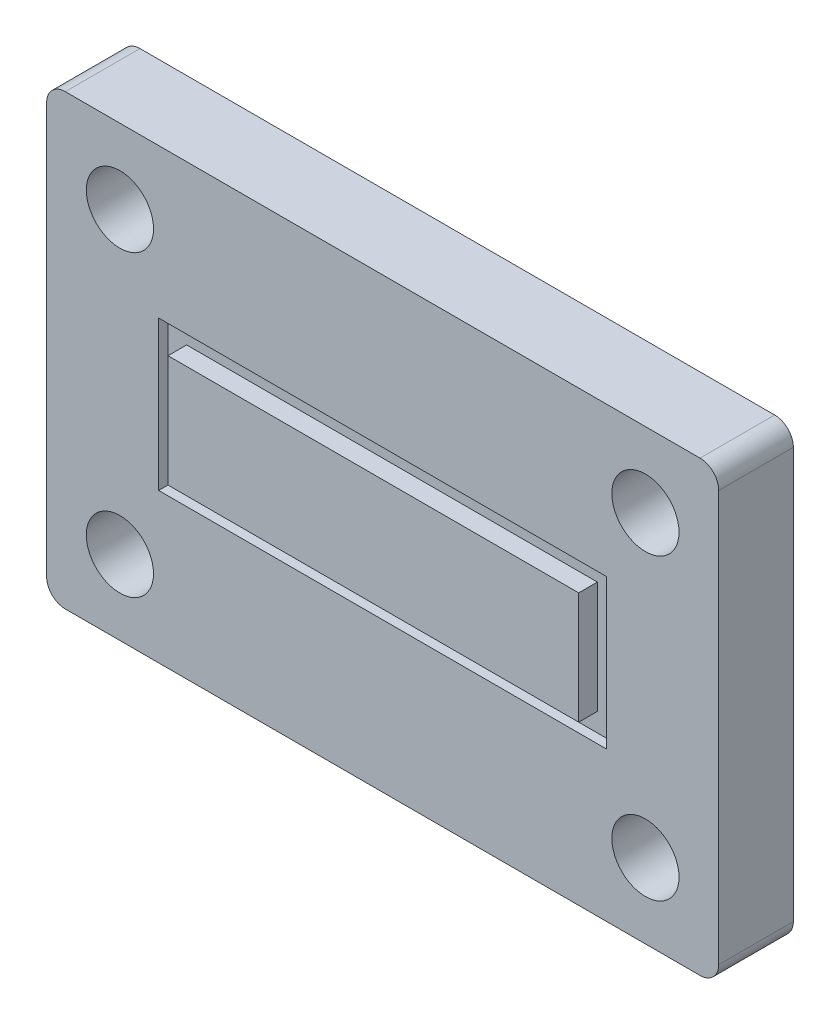
from build123d import *

# Parameters (mm, degrees)
SKETCH1_W                = 36
SKETCH1_H                = 24
BOSS_EXTRUDE1_DEPTH      = 4
M3_CLEARANCE_HOLE1_D     = 3.6
M3_CLEARANCE_HOLE1_DEPTH = 16
M3_CLEARANCE_HOLE1_TIP   = 1.081549114
FILLET1_R                = 1
SKETCH4_W                = 24
SKETCH4_H                = 8
CUT_EXTRUDE1_DEPTH       = 0.5
SKETCH5_W                = 22
SKETCH5_H                = 6
BOSS_EXTRUDE2_DEPTH      = 1


with BuildPart() as part:
    # Sketch1 → Boss-Extrude1 (new body)
    with BuildSketch(Plane.XY):
        with Locations((18, 12)):
            Rectangle(SKETCH1_W, SKETCH1_H)
    extrude(amount=BOSS_EXTRUDE1_DEPTH)

    # M3 Clearance Hole1
    with Locations(Plane.XY.offset(4)):
        with Locations((3.925, 20), (32.075, 20), (32.075, 4), (3.925, 4)):
            Hole(M3_CLEARANCE_HOLE1_D / 2, depth=M3_CLEARANCE_HOLE1_DEPTH)
            with Locations((0, 0, -(M3_CLEARANCE_HOLE1_DEPTH + M3_CLEARANCE_HOLE1_TIP / 2))):  # 118° drill point
                Cone(0, M3_CLEARANCE_HOLE1_D / 2, M3_CLEARANCE_HOLE1_TIP, mode=Mode.SUBTRACT)

    # Fillet1
    fillet1_edges = [part.edges().sort_by_distance(p)[0] for p in [
        (36, 24, 2),
        (36, 0, 2),
        (0, 0, 2),
        (0, 24, 2),
    ]]
    fillet(fillet1_edges, radius=FILLET1_R)

    # Sketch4 → Cut-Extrude1 (cut)
    with BuildSketch(Plane.XY.offset(4)):
        with Locations((18, 12)):
            Rectangle(SKETCH4_W, SKETCH4_H)
    extrude(amount=-CUT_EXTRUDE1_DEPTH, mode=Mode.SUBTRACT)


with BuildPart() as body_2:
    # Sketch5 → Boss-Extrude2 (new body)
    with BuildSketch(Plane.XY.offset(3.5)):
        with Locations((18, 12)):
            Rectangle(SKETCH5_W, SKETCH5_H)
    extrude(amount=BOSS_EXTRUDE2_DEPTH)


solid = Compound([part.part, body_2.part])
